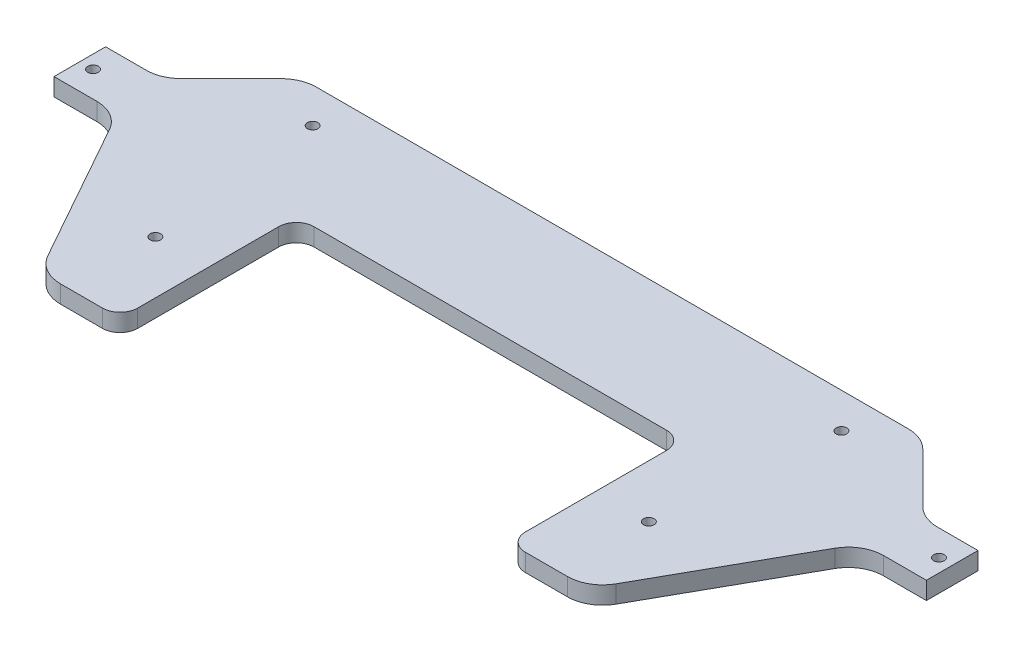
from build123d import *

# Parameters (mm, degrees)
SALIENTE_EXTRUIR1_DEPTH = 5
REDONDEO1_R             = 10
CROQUIS2_R              = 1.5
CORTAR_EXTRUIR1_DEPTH   = 135.669558943
CROQUIS4_W              = 110
CROQUIS4_H              = 50
CORTAR_EXTRUIR2_DEPTH   = 135.669558943
REDONDEO2_R             = 5
CROQUIS5_W              = 4
CROQUIS5_H              = 14.636342218
CORTAR_EXTRUIR3_DEPTH   = 135.669558943


with BuildPart() as part:
    # Croquis1 → Saliente-Extruir1 (new body)
    with BuildSketch(Plane(origin=(0, 0, 0), x_dir=(1, 0, 0), z_dir=(0, 1, 0))):
        Polygon((-88.1, 42.318171109), (88.1, 42.318171109), (108.1, 22.318171109), (127.75, 22.318171109), (127.75, 7.681828891), (105.75, 7.681828891), (77.75, -42.318171109), (-77.75, -42.318171109), (-105.75, 7.681828891), (-127.75, 7.681828891), (-127.75, 22.318171109), (-108.1, 22.318171109), align=None)
    extrude(amount=SALIENTE_EXTRUIR1_DEPTH)

    # Redondeo1
    redondeo1_edges = [part.edges().sort_by_distance(p)[0] for p in [
        (88.1, 2.5, -42.318171109),
        (-88.1, 2.5, -42.318171109),
        (-77.75, 2.5, 42.318171109),
        (77.75, 2.5, 42.318171109),
        (108.1, 2.5, -22.318171109),
        (105.75, 2.5, -7.681828891),
        (-105.75, 2.5, -7.681828891),
        (-108.1, 2.5, -22.318171109),
    ]]
    fillet(redondeo1_edges, radius=REDONDEO1_R)

    # Croquis2 → Cortar-Extruir1 (cut, through all)
    with BuildSketch(Plane(origin=(0, 5, 0), x_dir=(1, 0, 0), z_dir=(0, 1, 0))):
        with Locations((70, -17.318171109)):
            Circle(CROQUIS2_R)
        with Locations((-70, -17.318171109)):
            Circle(CROQUIS2_R)
        with Locations((-119.996067812, 15)):
            Circle(CROQUIS2_R)
        with Locations((119.996067812, 15)):
            Circle(CROQUIS2_R)
        with Locations((-75, 32.318171109)):
            Circle(CROQUIS2_R)
        with Locations((75, 32.318171109)):
            Circle(CROQUIS2_R)
        with Locations((-17.5, -17.318171109)):
            Circle(CROQUIS2_R)
        with Locations((17.5, -17.318171109)):
            Circle(CROQUIS2_R)
        with Locations((-17.5, -37.318171109)):
            Circle(CROQUIS2_R)
        with Locations((17.5, -37.318171109)):
            Circle(CROQUIS2_R)
    extrude(amount=-CORTAR_EXTRUIR1_DEPTH, mode=Mode.SUBTRACT)

    # Croquis4 → Cortar-Extruir2 (cut, through all)
    with BuildSketch(Plane(origin=(0, 5, 0), x_dir=(1, 0, 0), z_dir=(0, 1, 0))):
        with Locations((0, -17.318171109)):
            Rectangle(CROQUIS4_W, CROQUIS4_H)
    extrude(amount=-CORTAR_EXTRUIR2_DEPTH, mode=Mode.SUBTRACT)

    # Redondeo2
    redondeo2_edges = [part.edges().sort_by_distance(p)[0] for p in [
        (-55, 2.5, 42.318171109),
        (55, 2.5, 42.318171109),
        (55, 2.5, -7.681828891),
        (-55, 2.5, -7.681828891),
    ]]
    fillet(redondeo2_edges, radius=REDONDEO2_R)

    # Croquis5 → Cortar-Extruir3 (cut, through all)
    with BuildSketch(Plane(origin=(0, 5, 0), x_dir=(1, 0, 0), z_dir=(0, 1, 0))):
        with Locations((-125.75, 15)):
            Rectangle(CROQUIS5_W, CROQUIS5_H)
        with Locations((125.75, 15)):
            Rectangle(CROQUIS5_W, CROQUIS5_H)
    extrude(amount=-CORTAR_EXTRUIR3_DEPTH, mode=Mode.SUBTRACT)


solid = part.part
